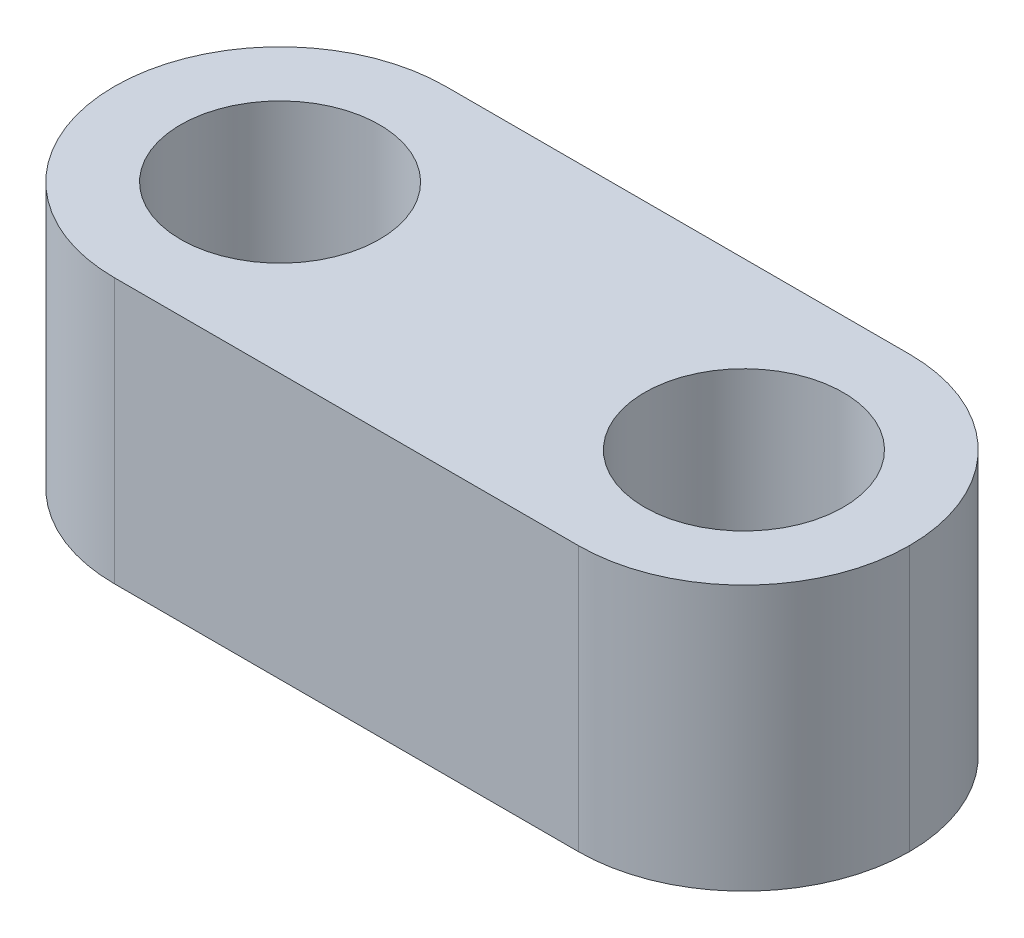
from build123d import *

# Parameters (mm, degrees)
SKETCH1_W           = 12
SKETCH1_H           = 5
BOSS_EXTRUDE1_DEPTH = 4
SKETCH2_R           = 1.5
CUT_EXTRUDE1_DEPTH  = 4
SKETCH3_R           = 1.5
CUT_EXTRUDE2_DEPTH  = 4
FILLET1_R           = 2.5


with BuildPart() as part:
    # Sketch1 → Boss-Extrude1 (new body)
    with BuildSketch(Plane(origin=(0, 0, 0), x_dir=(1, 0, 0), z_dir=(0, 1, 0))):
        Rectangle(SKETCH1_W, SKETCH1_H)
    extrude(amount=BOSS_EXTRUDE1_DEPTH)

    # Sketch2 → Cut-Extrude1 (cut)
    with BuildSketch(Plane(origin=(0, 4, 0), x_dir=(1, 0, 0), z_dir=(0, 1, 0))):
        with Locations(Location((3.5, 0, 0), (0, 0, 270))):
            Circle(SKETCH2_R)
    extrude(amount=-CUT_EXTRUDE1_DEPTH, mode=Mode.SUBTRACT)

    # Sketch3 → Cut-Extrude2 (cut)
    with BuildSketch(Plane(origin=(0, 4, 0), x_dir=(1, 0, 0), z_dir=(0, 1, 0))):
        with Locations(Location((-3.5, 0, 0), (0, 0, 270))):
            Circle(SKETCH3_R)
    extrude(amount=-CUT_EXTRUDE2_DEPTH, mode=Mode.SUBTRACT)

    # Fillet1
    fillet1_edges = [part.edges().sort_by_distance(p)[0] for p in [
        (6, 2, 2.5),
        (6, 2, -2.5),
        (-6, 2, 2.5),
        (-6, 2, -2.5),
    ]]
    fillet(fillet1_edges, radius=FILLET1_R - 0.0001)  # a hair under: the kernel refuses the full size


solid = part.part
